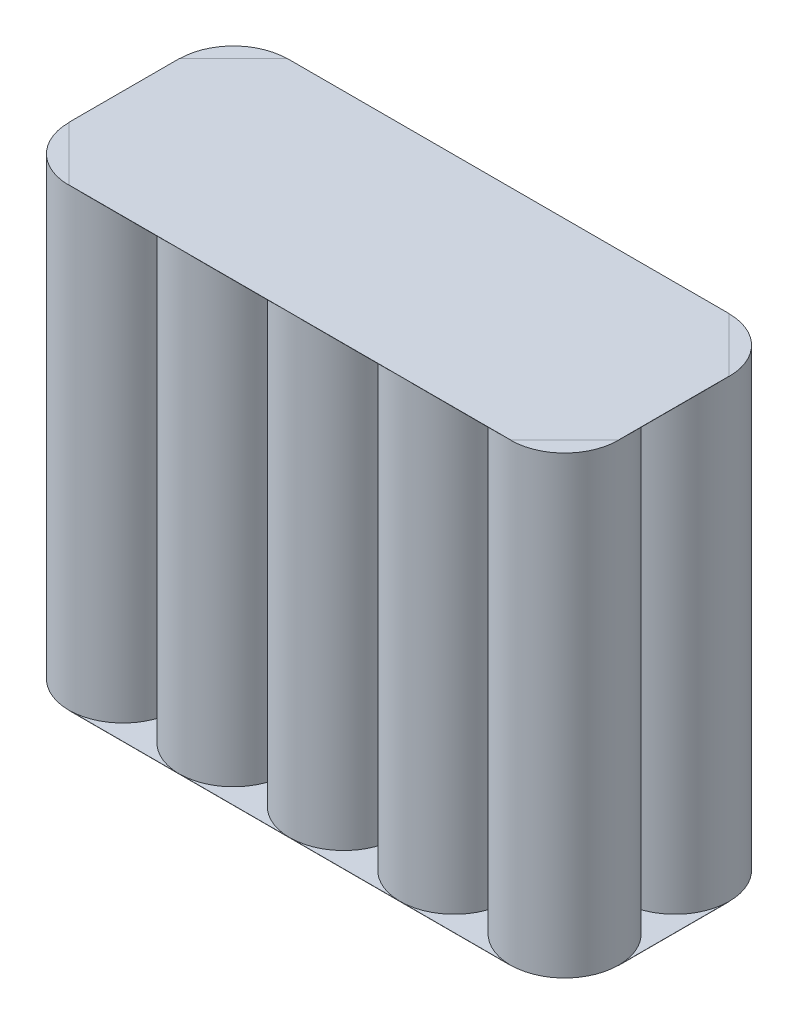
from build123d import *

# Parameters (mm, degrees)
SKETCH1_R              = 6.35
BOSS_EXTRUDE1_DEPTH    = 50.8
SKETCH1_R_2            = 6.349999999999999
BOSS_EXTRUDE1_2_DEPTH  = 50.8
SKETCH1_R_3            = 6.350000000000002
BOSS_EXTRUDE1_3_DEPTH  = 50.8
BOSS_EXTRUDE1_4_DEPTH  = 50.8
BOSS_EXTRUDE1_5_DEPTH  = 50.8
BOSS_EXTRUDE1_6_DEPTH  = 50.8
BOSS_EXTRUDE1_7_DEPTH  = 50.8
SKETCH1_R_4            = 6.350000000000003
BOSS_EXTRUDE1_8_DEPTH  = 50.8
BOSS_EXTRUDE1_9_DEPTH  = 50.8
SKETCH1_R_5            = 6.3500000000000005
BOSS_EXTRUDE1_10_DEPTH = 50.8
BOSS_EXTRUDE2_DEPTH    = 1.27
BOSS_EXTRUDE3_DEPTH    = 0.0254


with BuildPart() as part:
    # Sketch1 → Boss-Extrude1 (new body)
    with BuildSketch(Plane(origin=(0, 0, 0), x_dir=(1, 0, 0), z_dir=(0, 1, 0))):
        Circle(SKETCH1_R)
    extrude(amount=BOSS_EXTRUDE1_DEPTH)



with BuildPart() as body_2:
    # Sketch1 → Boss-Extrude1 2 (new body)
    with BuildSketch(Plane(origin=(0, 0, 0), x_dir=(1, 0, 0), z_dir=(0, 1, 0))):
        with Locations((12.954, 0)):
            Circle(SKETCH1_R_2)
    extrude(amount=BOSS_EXTRUDE1_2_DEPTH)


with BuildPart() as body_3:
    # Sketch1 → Boss-Extrude1 3 (new body)
    with BuildSketch(Plane(origin=(0, 0, 0), x_dir=(1, 0, 0), z_dir=(0, 1, 0))):
        with Locations((25.908, 0)):
            Circle(SKETCH1_R_3)
    extrude(amount=BOSS_EXTRUDE1_3_DEPTH)


with BuildPart() as body_4:
    # Sketch1 → Boss-Extrude1 4 (new body)
    with BuildSketch(Plane(origin=(0, 0, 0), x_dir=(1, 0, 0), z_dir=(0, 1, 0))):
        with Locations((38.862, 0)):
            Circle(SKETCH1_R_3)
    extrude(amount=BOSS_EXTRUDE1_4_DEPTH)


with BuildPart() as body_5:
    # Sketch1 → Boss-Extrude1 5 (new body)
    with BuildSketch(Plane(origin=(0, 0, 0), x_dir=(1, 0, 0), z_dir=(0, 1, 0))):
        with Locations((51.816, 0)):
            Circle(SKETCH1_R_3)
    extrude(amount=BOSS_EXTRUDE1_5_DEPTH)


with BuildPart() as body_6:
    # Sketch1 → Boss-Extrude1 6 (new body)
    with BuildSketch(Plane(origin=(0, 0, 0), x_dir=(1, 0, 0), z_dir=(0, 1, 0))):
        with Locations((12.954000000000136, -12.954)):
            Circle(SKETCH1_R)
    extrude(amount=BOSS_EXTRUDE1_6_DEPTH)


with BuildPart() as body_7:
    # Sketch1 → Boss-Extrude1 7 (new body)
    with BuildSketch(Plane(origin=(0, 0, 0), x_dir=(1, 0, 0), z_dir=(0, 1, 0))):
        with Locations((25.908000000000136, -12.954)):
            Circle(SKETCH1_R)
    extrude(amount=BOSS_EXTRUDE1_7_DEPTH)


with BuildPart() as body_8:
    # Sketch1 → Boss-Extrude1 8 (new body)
    with BuildSketch(Plane(origin=(0, 0, 0), x_dir=(1, 0, 0), z_dir=(0, 1, 0))):
        with Locations((38.86200000000014, -12.954)):
            Circle(SKETCH1_R_4)
    extrude(amount=BOSS_EXTRUDE1_8_DEPTH)


with BuildPart() as body_9:
    # Sketch1 → Boss-Extrude1 9 (new body)
    with BuildSketch(Plane(origin=(0, 0, 0), x_dir=(1, 0, 0), z_dir=(0, 1, 0))):
        with Locations((51.81600000000014, -12.954)):
            Circle(SKETCH1_R_4)
    extrude(amount=BOSS_EXTRUDE1_9_DEPTH)


with BuildPart() as body_10:
    # Sketch1 → Boss-Extrude1 10 (new body)
    with BuildSketch(Plane(origin=(0, 0, 0), x_dir=(1, 0, 0), z_dir=(0, 1, 0))):
        with Locations((1.3569e-13, -12.954)):
            Circle(SKETCH1_R_5)
    extrude(amount=BOSS_EXTRUDE1_10_DEPTH)


with BuildPart() as part_1:
    add(part.part)

    add(body_2.part)  # Boss-Extrude2 merges body 2

    add(body_3.part)  # Boss-Extrude2 merges body 3

    add(body_4.part)  # Boss-Extrude2 merges body 4

    add(body_5.part)  # Boss-Extrude2 merges body 5

    add(body_6.part)  # Boss-Extrude2 merges body 6

    add(body_7.part)  # Boss-Extrude2 merges body 7

    add(body_8.part)  # Boss-Extrude2 merges body 8

    add(body_9.part)  # Boss-Extrude2 merges body 9

    add(body_10.part)  # Boss-Extrude2 merges body 10
    # Sketch4 → Boss-Extrude2 (add)
    with BuildSketch(Plane(origin=(0, 50.8, 0), x_dir=(1, 0, 0), z_dir=(0, 1, 0))):
        with BuildLine():
            Line((1.3569e-13, -6.604), (0, -6.35))
            ThreePointArc((0, -6.35), (-4.490128060534576, 4.490128060534577), (6.35, 0))
            Line((6.35, 0), (6.603999999999998, 0))
            ThreePointArc((6.603999999999998, 0), (12.954, 6.350000000000001), (19.304000000000002, 0))
            Line((19.304000000000002, 0), (19.558, 0))
            ThreePointArc((19.558, 0), (25.908, 6.350000000000001), (32.258, 0))
            Line((32.258, 0), (32.512, 0))
            ThreePointArc((32.512, 0), (38.862, 6.350000000000001), (45.212, 0))
            Line((45.212, 0), (45.466, 0))
            ThreePointArc((45.466, 0), (56.30612806053458, 4.490128060534578), (51.816, -6.350000000000002))
            Line((51.816, -6.350000000000002), (51.81600000000014, -6.603999999999998))
            ThreePointArc((51.81600000000014, -6.603999999999998), (56.30612806053472, -17.44412806053458), (45.466000000000136, -12.954))
            Line((45.466000000000136, -12.954), (45.21200000000014, -12.954))
            ThreePointArc((45.21200000000014, -12.954), (38.86200000000014, -19.304000000000002), (32.512000000000135, -12.954))
            Line((32.512000000000135, -12.954), (32.25800000000013, -12.954))
            ThreePointArc((32.25800000000013, -12.954), (25.908000000000136, -19.304), (19.55800000000014, -12.954))
            Line((19.55800000000014, -12.954), (19.304000000000133, -12.954))
            ThreePointArc((19.304000000000133, -12.954), (12.954000000000134, -19.304), (6.604000000000137, -12.954))
            Line((6.604000000000137, -12.954), (6.350000000000135, -12.954))
            ThreePointArc((6.350000000000135, -12.954), (-4.490128060534443, -17.444128060534577), (1.3569e-13, -6.604))
        make_face()
    boss_extrude2 = extrude(amount=BOSS_EXTRUDE2_DEPTH)

    # Mirror1: Boss-Extrude2 across plane
    add(boss_extrude2.mirror(Plane.ZX.offset(25.4)))

    # Sketch5 → Boss-Extrude3 (add)
    with BuildSketch(Plane(origin=(0, 52.07, 0), x_dir=(1, 0, 0), z_dir=(0, 1, 0))):
        Polygon((51.81599999999998, 6.350000000000001), (-2.602e-14, 6.349999999999999), (-6.35, -4.434e-14), (-6.349999999999865, -12.954000000000045), (2.5457e-13, -19.304000000000002), (51.81600000000021, -19.304000000000002), (58.16600000000014, -12.95399999999983), (58.166000000000004, 0), align=None)
    boss_extrude3 = extrude(amount=BOSS_EXTRUDE3_DEPTH)

    # Mirror2: Boss-Extrude3 across plane
    add(boss_extrude3.mirror(Plane.ZX.offset(25.4)))


solid = part_1.part
